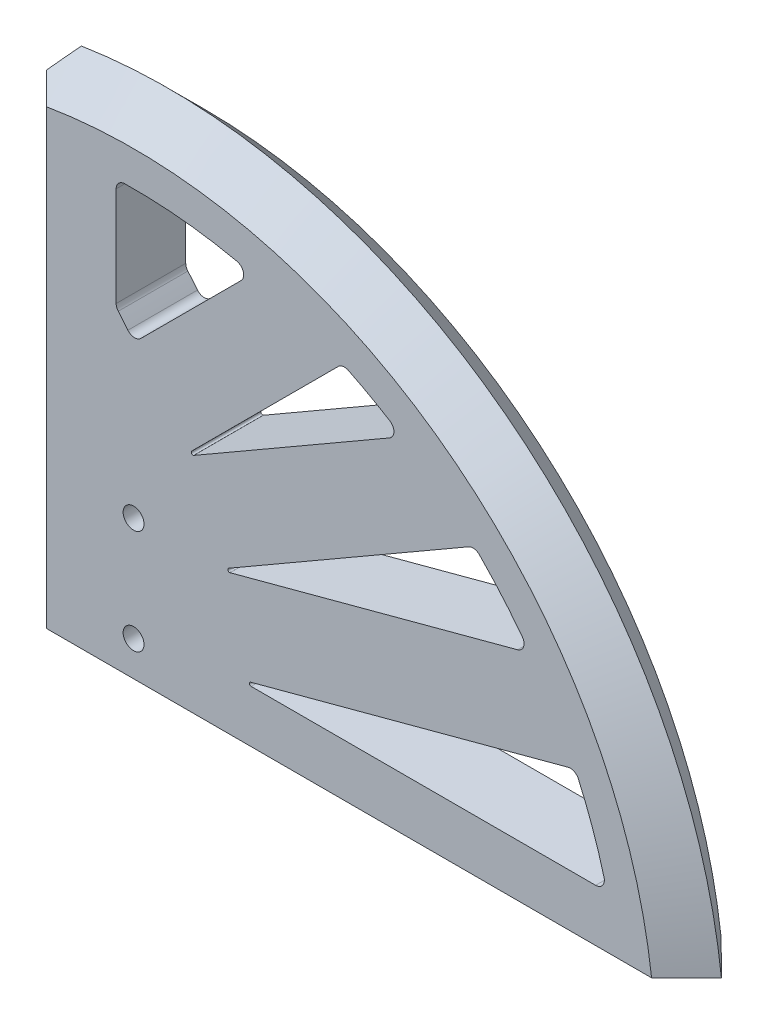
from build123d import *

# Parameters (mm, degrees)
SKETCH1_R           = 0.6
BOSS_EXTRUDE1_DEPTH = 4
FILLET3_R           = 0.1
FILLET4_R           = 0.5
SKETCH6_W           = 5.5
SKETCH6_H           = 1.5
CUT_EXTRUDE3_DEPTH  = 12.5
CHAMFER5_SIZE       = 2
CHAMFER6_SIZE       = 2
CHAMFER7_SIZE       = 3
CHAMFER8_SIZE       = 1


with BuildPart() as part:
    # Sketch1 → Boss-Extrude1 (new body)
    with BuildSketch(Plane.XY):
        with BuildLine():
            Line((0, 27.832467291), (0, 0))
            Line((0, 0), (37.79685519, 0))
            ThreePointArc((37.79685519, 0), (24.974482689, 22.16759606), (0, 27.832467291))
        make_face()
        with Locations((6, 2)):
            Circle(SKETCH1_R, mode=Mode.SUBTRACT)
        with Locations((6, 8)):
            Circle(SKETCH1_R, mode=Mode.SUBTRACT)
        with BuildLine():
            Line((33.211027176, 3), (12, 3))
            Line((12, 3), (31.393734472, 8.19653549))
            ThreePointArc((31.393734472, 8.19653549), (32.430403559, 5.643038878), (33.211027176, 3))
        make_face(mode=Mode.SUBTRACT)
        with BuildLine():
            Line((28.785067971, 12.67392631), (10.80845767, 7.857108097))
            Line((10.80845767, 7.857108097), (25.599351889, 16.396634856))
            ThreePointArc((25.599351889, 16.396634856), (27.273796122, 14.605098147), (28.785067971, 12.67392631))
        make_face(mode=Mode.SUBTRACT)
        with BuildLine():
            ThreePointArc((6.022317364, 16.759671956), (5.519466967, 17.386683928), (5, 18))
            Line((5, 18), (5, 24.382137159))
            ThreePointArc((5, 24.382137159), (8.938861294, 24.245342416), (12.819495121, 23.556849712))
            Line((12.819495121, 23.556849712), (6.022317364, 16.759671956))
        make_face(mode=Mode.SUBTRACT)
        with BuildLine():
            ThreePointArc((18.021652475, 21.687939255), (19.760252022, 20.785558519), (21.431506729, 19.763831023))
            Line((21.431506729, 19.763831023), (8.811215985, 12.477502764))
            Line((8.811215985, 12.477502764), (18.021652475, 21.687939255))
        make_face(mode=Mode.SUBTRACT)
    extrude(amount=BOSS_EXTRUDE1_DEPTH)

    # Fillet3
    fillet3_edges = [part.edges().sort_by_distance(p)[0] for p in [
        (12, 3, 2),
        (10.80845767, 7.857108097, 2),
        (8.811215985, 12.477502764, 2),
    ]]
    fillet(fillet3_edges, radius=FILLET3_R)

    # Fillet4
    fillet4_edges = [part.edges().sort_by_distance(p)[0] for p in [
        (6.022317364, 16.759671956, 2),
        (12.819495121, 23.556849712, 2),
        (5, 24.382137159, 2),
        (5, 18, 2),
        (33.211027176, 3, 2),
        (31.393734472, 8.19653549, 2),
        (28.785067971, 12.67392631, 2),
        (25.599351889, 16.396634856, 2),
        (21.431506729, 19.763831023, 2),
        (18.021652475, 21.687939255, 2),
    ]]
    fillet(fillet4_edges, radius=FILLET4_R)

    # Sketch6 → Cut-Extrude3 (cut)
    with BuildSketch(Plane.XZ):
        with Locations((6, 2)):
            Rectangle(SKETCH6_W, SKETCH6_H)
    extrude(amount=-CUT_EXTRUDE3_DEPTH, mode=Mode.SUBTRACT)

    # Chamfer5
    chamfer5_edges = [part.edges().sort_by_distance(p)[0] for p in [
        (24.974482689, 22.16759606, 0),
    ]]
    chamfer(chamfer5_edges, length=CHAMFER5_SIZE)

    # Chamfer6
    chamfer6_edges = [part.edges().sort_by_distance(p)[0] for p in [
        (24.974482689, 22.16759606, 4),
    ]]
    chamfer(chamfer6_edges, length=CHAMFER6_SIZE - 0.0001)  # a hair under: the kernel refuses the full size

    # Chamfer7
    chamfer7_edges = [part.edges().sort_by_distance(p)[0] for p in [
        (0, 12.896938457, 0),
    ]]
    chamfer(chamfer7_edges, length=CHAMFER7_SIZE)

    # Chamfer8
    chamfer8_edges = [part.edges().sort_by_distance(p)[0] for p in [
        (0, 12.896989488, 4),
    ]]
    chamfer(chamfer8_edges, length=CHAMFER8_SIZE - 0.0001)  # a hair under: the kernel refuses the full size


solid = part.part
